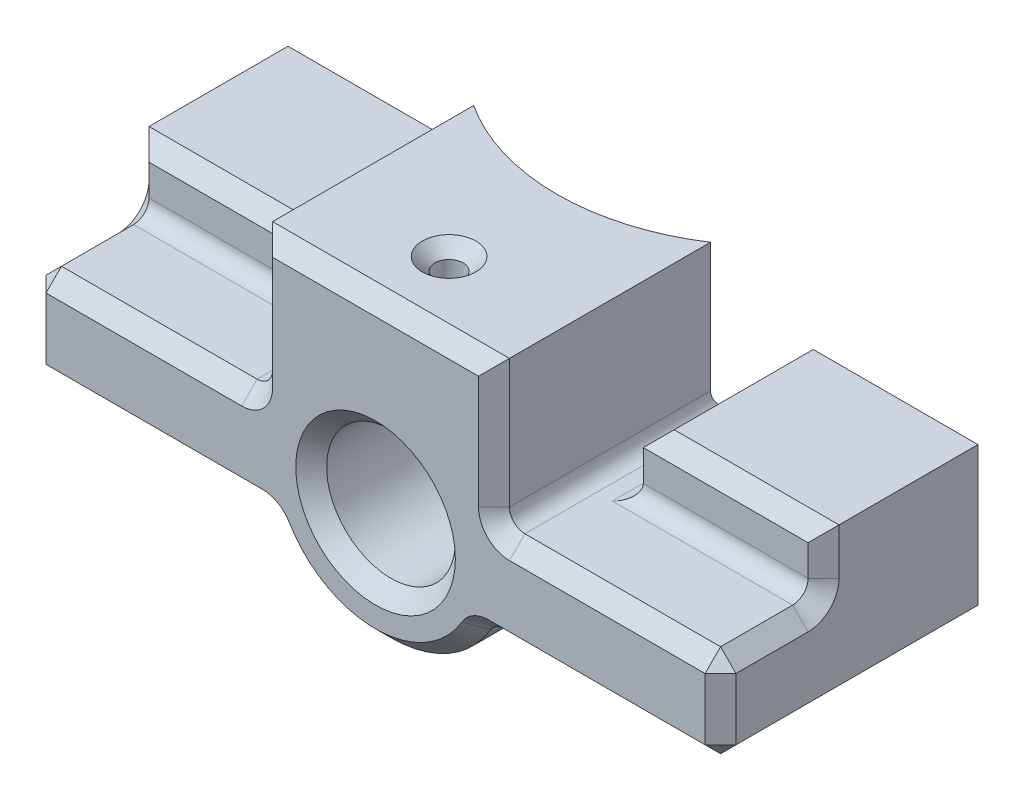
from build123d import *

# Parameters (mm, degrees)
SKETCH1_R               = 12.5
BOSS_EXTRUDE1_DEPTH     = 50
SKETCH2_W               = 35
SKETCH2_H               = 30
BOSS_EXTRUDE2_DEPTH     = 30
CUT_EXTRUDE1_DEPTH      = 92.021975369
CUT_EXTRUDE1_DEPTH_BACK = 92.021975369
FILLET2_R               = 3
CHAMFER1_SIZE           = 3


# Read off the part's stored shape, not the designer's step: Ø5.5 (5.5) Diameter Hole1
with BuildPart() as part:
    # Sketch1 → Boss-Extrude1 (new body)
    with BuildSketch(Plane.XY):
        with BuildLine():
            Line((23, 8), (67, 8))
            Line((67, 8), (67, -10))
            Line((67, -10), (20.155644371, -10))
            ThreePointArc((20.155644371, -10), (0, -22.5), (-20.155644371, -10))
            Line((-20.155644371, -10), (-67, -10))
            Line((-67, -10), (-67, 8))
            Line((-67, 8), (-23, 8))
            Line((-23, 8), (-23, 36))
            Line((-23, 36), (23, 36))
            Line((23, 36), (23, 8))
        make_face()
        Circle(SKETCH1_R, mode=Mode.SUBTRACT)
    extrude(amount=-BOSS_EXTRUDE1_DEPTH)

    # Sketch2 → Boss-Extrude2 (add)
    with BuildSketch(Plane.XZ.offset(10)):
        with Locations((49.5, -35)):
            Rectangle(SKETCH2_W, SKETCH2_H)
        with Locations((-49.5, -35)):
            Rectangle(SKETCH2_W, SKETCH2_H)
    extrude(amount=-BOSS_EXTRUDE2_DEPTH)

    # Sketch3 → Cut-Extrude1 (cut, two sides: drawn at the far end of the back side and taken through both)
    with BuildSketch(Plane(origin=(0, 0, 0), x_dir=(1, 0, 0), z_dir=(0, 1, 0)).offset(-CUT_EXTRUDE1_DEPTH_BACK)):
        with BuildLine():
            Line((-32, 50), (-32, 55))
            Line((-32, 55), (32, 55))
            Line((32, 55), (32, 50))
            ThreePointArc((32, 50), (0, 35.202941017), (-32, 50))
        make_face()
    extrude(amount=CUT_EXTRUDE1_DEPTH + CUT_EXTRUDE1_DEPTH_BACK, mode=Mode.SUBTRACT)

    # Ø5.5 (5.5) Diameter Hole1 outline → Ø5.5 (5.5) Diameter Hole1 (revolve, cut)
    with BuildSketch(Plane.XY.offset(-14.276580189)):
        Polygon((0, 12.193702386), (2.75, 12.193702386), (2.75, 33.55), (5.2, 36), (0, 36), align=None)
    revolve(axis=Axis((0, 0, -14.276580189), (0, 1, 0)), mode=Mode.SUBTRACT)

    # Fillet2
    fillet2_edges = [part.edges().sort_by_distance(p)[0] for p in [
        (49.5, 8, -20),
        (-49.5, 8, -20),
        (-32, 8, -35),
        (32, 8, -35),
        (23, 8, -21.030187118),
        (-23, 8, -21.030187118),
        (20.155644371, -10, -20.177640831),
        (-20.155644371, -10, -20.177640831),
    ]]
    fillet(fillet2_edges, radius=FILLET2_R)

    # Chamfer1
    chamfer1_edges = [part.edges().sort_by_distance(p)[0] for p in [
        (-23, 23.5, 0),
        (0, 36, 0),
        (46.5, 8, 0),
        (67, -1, 0),
        (67, 8, -8.5),
        (-67, 8, -8.5),
        (-46.5, 8, 0),
        (23, 23.5, 0),
        (0, -22.5, 0),
        (-44.468705484, -10, 0),
        (44.468705484, -10, 0),
        (67, 8.878679656, -19.121320344),
        (-67, 8.878679656, -19.121320344),
        (-67, -1, 0),
        (23.878679656, 8.878679656, 0),
        (-23.878679656, 8.878679656, 0),
        (20.452189654, -10.393447172, 0),
        (-20.452189654, -10.393447172, 0),
        (67, -10, -25),
        (-67, -10, -25),
        (-12.5, 0, 0),
        (67, 15.5, -20),
        (32, 20, -35),
        (49.5, 20, -20),
        (-32, 20, -35),
        (-67, 15.5, -20),
        (-49.5, 20, -20),
    ]]
    chamfer(chamfer1_edges, length=CHAMFER1_SIZE)


solid = part.part
